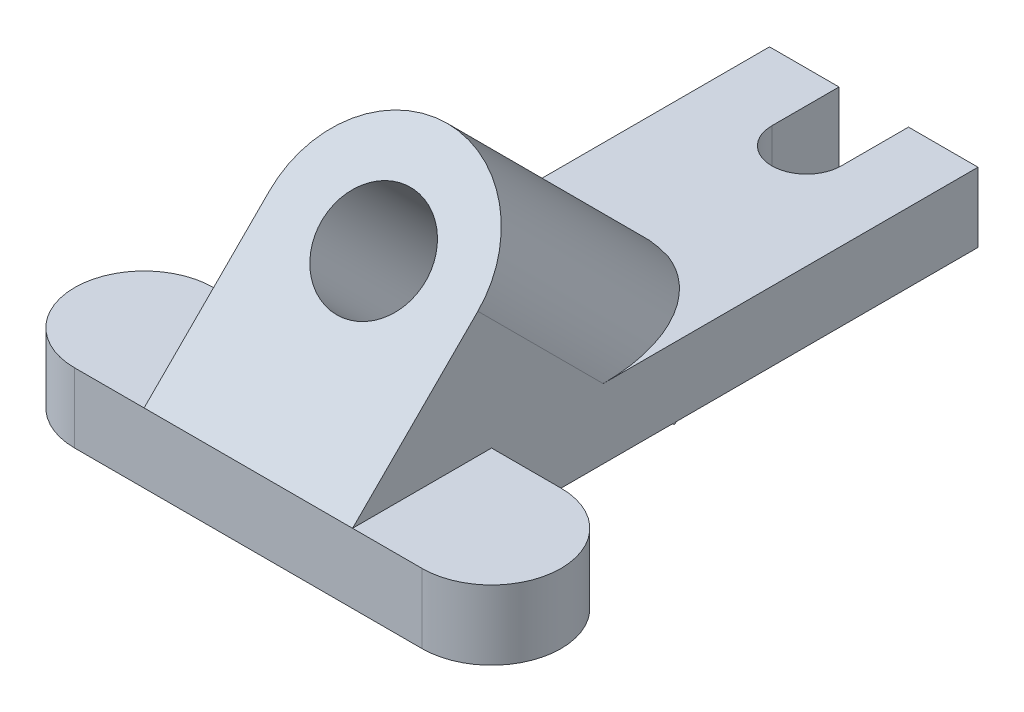
from build123d import *

# Parameters (mm, degrees)
SKETCH1_W           = 180
SKETCH1_H           = 20
BOSS_EXTRUDE1_DEPTH = 60
BOSS_EXTRUDE2_DEPTH = 60
BOSS_EXTRUDE4_DEPTH = 80
SKETCH8_R           = 15
CUT_EXTRUDE1_DEPTH  = 80
BOSS_EXTRUDE5_DEPTH = 20
CUT_EXTRUDE2_DEPTH  = 20


with BuildPart() as part:
    # Sketch1 → Boss-Extrude1 (new body)
    with BuildSketch(Plane(origin=(0, 0, 0), x_dir=(0, 0, -1), z_dir=(1, 0, 0))):
        with Locations((-19.674418605, 19.441860465)):
            Rectangle(SKETCH1_W, SKETCH1_H)
    extrude(amount=-BOSS_EXTRUDE1_DEPTH)

    # Sketch6 → Boss-Extrude2 (add)
    with BuildSketch(Plane(origin=(0, 0, 0), x_dir=(0, 0, -1), z_dir=(1, 0, 0))):
        Polygon((-109.674418605, 29.441860465), (-73.611972764, 65.504306306), (-37.549526924, 29.441860465), align=None)
    extrude(amount=-BOSS_EXTRUDE2_DEPTH)

    # Sketch7 → Boss-Extrude4 (add)
    with BuildSketch(Plane(origin=(0, 69.558139535, 69.558139535), x_dir=(1, 0, 0), z_dir=(0, 0.7071067811865512, 0.7071067811865438))):
        with BuildLine():
            ThreePointArc((0, -5.732985932), (-30, 24.267014068), (-60, -5.732985932))
            Line((-60, -5.732985932), (0, -5.732985932))
        make_face()
    extrude(amount=-BOSS_EXTRUDE4_DEPTH)

    # Sketch8 → Cut-Extrude1 (cut)
    with BuildSketch(Plane(origin=(0, 69.558139535, 69.558139535), x_dir=(1, 0, 0), z_dir=(0, 0.7071067811865512, 0.7071067811865438))):
        with Locations((-30, -5.732985932)):
            Circle(SKETCH8_R)
    extrude(amount=-CUT_EXTRUDE1_DEPTH, mode=Mode.SUBTRACT)

    # Sketch9 → Boss-Extrude5 (add)
    with BuildSketch(Plane(origin=(0, 29.441860465, 0), x_dir=(1, 0, 0), z_dir=(0, 1, 0))):
        with BuildLine():
            Line((0, -109.674418605), (20, -109.674418605))
            ThreePointArc((20, -109.674418605), (40, -89.674418605), (20, -69.674418605))
            Line((20, -69.674418605), (0, -69.674418605))
            Line((0, -69.674418605), (0, -109.674418605))
        make_face()
        with BuildLine():
            Line((-60, -109.674418605), (-80, -109.674418605))
            ThreePointArc((-80, -109.674418605), (-100, -89.674418605), (-80, -69.674418605))
            Line((-80, -69.674418605), (-60, -69.674418605))
            Line((-60, -69.674418605), (-60, -109.674418605))
        make_face()
    extrude(amount=-BOSS_EXTRUDE5_DEPTH)

    # Sketch10 → Cut-Extrude2 (cut)
    with BuildSketch(Plane(origin=(0, 29.441860465, 0), x_dir=(1, 0, 0), z_dir=(0, 1, 0))):
        with BuildLine():
            Line((-20, 70.325581395), (-20, 50.988338914))
            ThreePointArc((-20, 50.988338914), (-30, 40.988338914), (-40, 50.988338914))
            Line((-40, 50.988338914), (-40, 70.325581395))
            ThreePointArc((-40, 70.325581395), (-30, 80.325581395), (-20, 70.325581395))
        make_face()
    extrude(amount=-CUT_EXTRUDE2_DEPTH, mode=Mode.SUBTRACT)


solid = part.part
